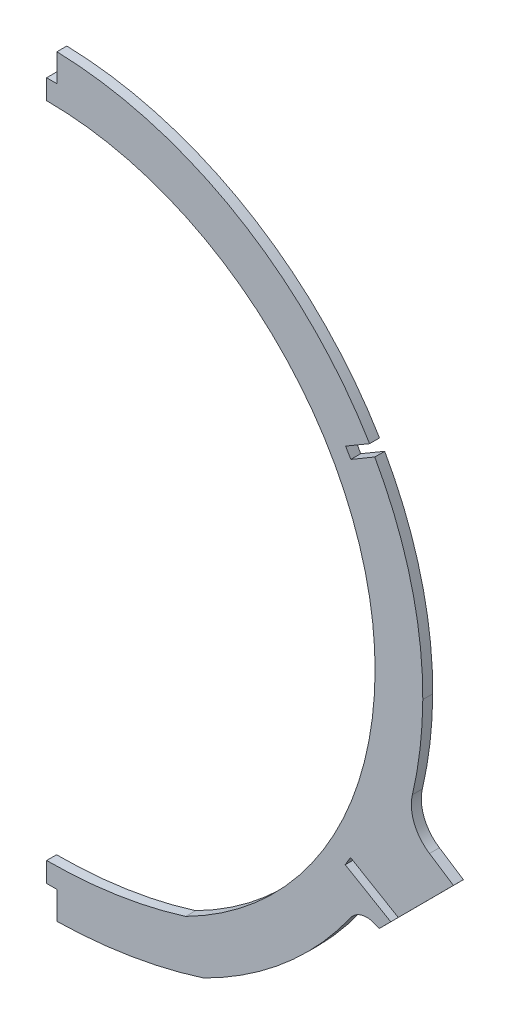
from build123d import *

# Parameters (mm, degrees)
BOSS_EXTRUDE1_DEPTH = 1.5875
SKETCH3_W           = 208.645691316
SKETCH3_H           = 383.026987577
CUT_EXTRUDE1_DEPTH  = 184.927178997
BOSS_EXTRUDE2_DEPTH = 1.5875
FILLET1_R           = 6.35
FILLET2_R           = 12.7
SKETCH6_W           = 3.302
SKETCH6_H           = 12.7
CUT_EXTRUDE2_DEPTH  = 191.500416859


with BuildPart() as part:
    # Sketch2 → Boss-Extrude1 (new, symmetric)
    with BuildSketch(Plane.XY):
        with BuildLine():
            ThreePointArc((-120.098895727, 19.05), (0.406748907, 139.2017743), (120.203613722, 18.343301545))
            ThreePointArc((120.203613722, 18.343301545), (101.067699546, -47.629728931), (50.138751442, -93.726))
            ThreePointArc((50.138751442, -93.726), (0.040174098, -101.514794876), (-50.058403246, -93.726))
            ThreePointArc((-50.058403246, -93.726), (-101.163912713, -47.327889321), (-120.098895727, 19.05))
        make_face()
        with BuildLine():
            ThreePointArc((-104.858895727, 19.05), (0.361930242, 123.961840203), (104.963877332, 18.432938489))
            ThreePointArc((104.963877332, 18.432938489), (88.446745877, -39.065849025), (44.40486057, -79.553359885))
            ThreePointArc((44.40486057, -79.553359885), (0.040463589, -86.274794876), (-44.323959374, -79.553531384))
            ThreePointArc((-44.323959374, -79.553531384), (-88.517658334, -38.801393502), (-104.858895727, 19.05))
        make_face(mode=Mode.SUBTRACT)
    extrude(amount=BOSS_EXTRUDE1_DEPTH, both=True)

    # Sketch3 → Cut-Extrude1 (cut, through all)
    with BuildSketch(Plane(origin=(0, 0, 0), x_dir=(0, 0, -1), z_dir=(1, 0, 0))):
        with Locations((4.266053154, 20.866300598)):
            Rectangle(SKETCH3_W, SKETCH3_H)
    extrude(amount=-CUT_EXTRUDE1_DEPTH, mode=Mode.SUBTRACT)

    # Sketch5 → Boss-Extrude2 (add, symmetric)
    with BuildSketch(Plane.XY):
        Polygon((106.258152496, -51.988683319), (130.011728615, -28.168431361), (114.573822099, -18.142937646), (100.046993583, -49.235229101), align=None)
    extrude(amount=BOSS_EXTRUDE2_DEPTH, both=True)

    # Fillet1
    fillet1_edges = [part.edges().sort_by_distance(p)[0] for p in [
        (100.046993583, -49.235229101, 0),
    ]]
    fillet(fillet1_edges, radius=FILLET1_R)

    # Fillet2
    fillet2_edges = [part.edges().sort_by_distance(p)[0] for p in [
        (114.573822099, -18.142937646, 0),
    ]]
    fillet(fillet2_edges, radius=FILLET2_R)

    # Sketch6 → Cut-Extrude2 (cut, through all)
    with BuildSketch(Plane.XY.offset(1.5875)):
        with Locations((1.651, 136.662280289)):
            Rectangle(SKETCH6_W, SKETCH6_H)
        Polygon((108.166218002, 79.740204673), (106.494925174, 82.588008087), (95.541835122, 76.159958748), (97.21312795, 73.312155334), align=None)
        Polygon((95.424252626, -39.741107061), (97.095545407, -36.89330362), (118.130209204, -49.237934313), (116.458916422, -52.085737754), align=None)
        with Locations((1.651, -98.974789488)):
            Rectangle(SKETCH6_W, SKETCH6_H)
    extrude(amount=-CUT_EXTRUDE2_DEPTH, mode=Mode.SUBTRACT)


solid = part.part
